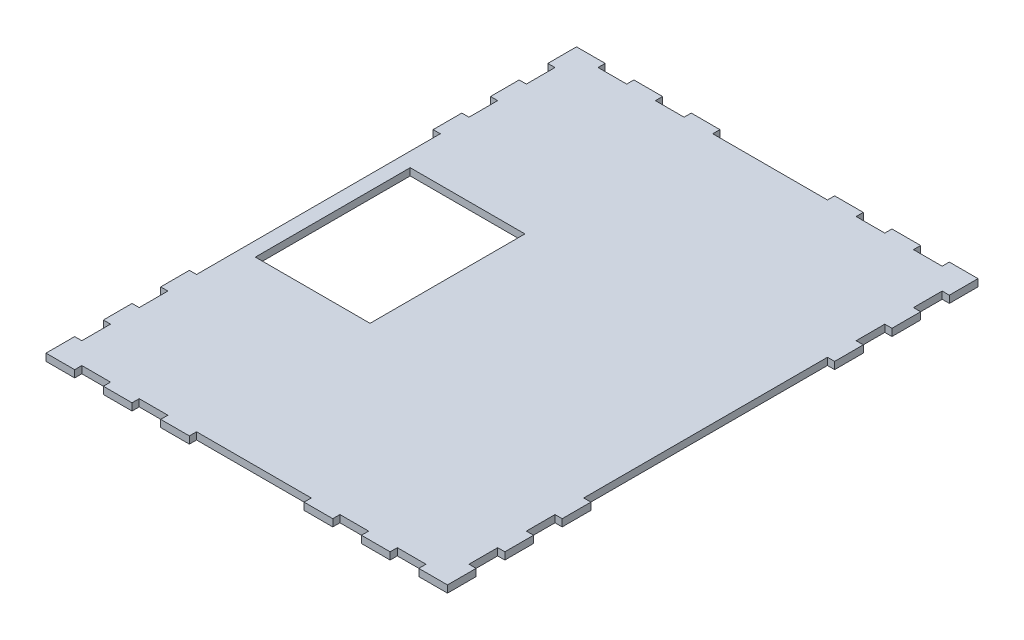
from build123d import *

# Parameters (mm, degrees)
BOSS_EXTRUDE1_DEPTH = 3.175
SKETCH5_W           = 50.8
SKETCH5_H           = 3.175
SKETCH5_W_2         = 12.7
CUT_EXTRUDE4_DEPTH  = 7.62
SKETCH7_W           = 50.8
SKETCH7_H           = 68.58
CUT_EXTRUDE5_DEPTH  = 7.62


with BuildPart() as part:
    # Sketch1 → Boss-Extrude1 (new body)
    with BuildSketch(Plane(origin=(0, 0, 0), x_dir=(1, 0, 0), z_dir=(0, 1, 0))):
        Polygon((3.175, 209.55), (0, 209.55), (0, 196.85), (3.175, 196.85), (3.175, 184.15), (0, 184.15), (0, 171.45), (3.175, 171.45), (3.175, 63.5), (0, 63.5), (0, 50.8), (3.175, 50.8), (3.175, 38.1), (0, 38.1), (0, 25.4), (3.175, 25.4), (3.175, 12.7), (0, 12.7), (0, 0), (177.8, 0), (177.8, 12.7), (174.625, 12.7), (174.625, 25.4), (177.8, 25.4), (177.8, 38.1), (174.625, 38.1), (174.625, 50.8), (177.8, 50.8), (177.8, 63.5), (174.625, 63.5), (174.625, 171.45), (177.8, 171.45), (177.8, 184.15), (174.625, 184.15), (174.625, 196.85), (177.8, 196.85), (177.8, 209.55), (174.625, 209.55), (174.625, 222.25), (177.8, 222.25), (177.8, 234.95), (0, 234.95), (0, 222.25), (3.175, 222.25), align=None)
    extrude(amount=BOSS_EXTRUDE1_DEPTH)

    # Sketch5 → Cut-Extrude4 (cut)
    with BuildSketch(Plane(origin=(0, 3.175, 0), x_dir=(1, 0, 0), z_dir=(0, 1, 0))):
        with Locations((88.9, 1.5875)):
            Rectangle(SKETCH5_W, SKETCH5_H)
        with Locations((44.45, 1.5875)):
            Rectangle(SKETCH5_W_2, SKETCH5_H)
        with Locations((133.35, 1.5875)):
            Rectangle(SKETCH5_W_2, SKETCH5_H)
        with Locations((19.05, 1.5875)):
            Rectangle(SKETCH5_W_2, SKETCH5_H)
        with Locations((158.75, 1.5875)):
            Rectangle(SKETCH5_W_2, SKETCH5_H)
    cut_extrude4 = extrude(amount=-CUT_EXTRUDE4_DEPTH, mode=Mode.SUBTRACT)

    # Mirror1: Cut-Extrude4 across plane
    add(cut_extrude4.mirror(Plane.XY.offset(-117.475)), mode=Mode.SUBTRACT)

    # Sketch7 → Cut-Extrude5 (cut)
    with BuildSketch(Plane(origin=(0, 3.175, 0), x_dir=(1, 0, 0), z_dir=(0, 1, 0))):
        with Locations((34.925, 117.475)):
            Rectangle(SKETCH7_W, SKETCH7_H)
    extrude(amount=-CUT_EXTRUDE5_DEPTH, mode=Mode.SUBTRACT)


solid = part.part
